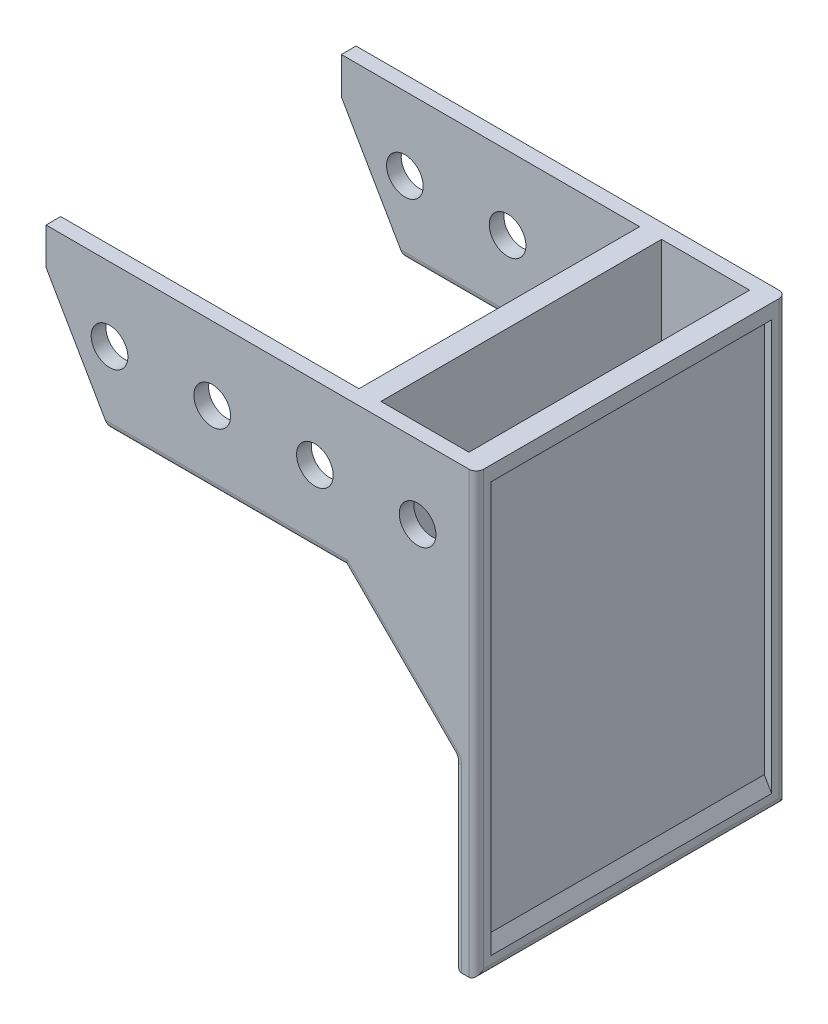
from build123d import *

# Parameters (mm, degrees)
SKETCH2_R           = 3.175
BOSS_EXTRUDE1_DEPTH = 2.54
SKETCH3_R           = 3.175
BOSS_EXTRUDE2_DEPTH = 2.54
SKETCH4_W           = 3.81
SKETCH4_H           = 25.4
BOSS_EXTRUDE3_DEPTH = 48.6
BOSS_EXTRUDE4_DEPTH = 50.8
LPATTERN1_COUNT     = 2
LPATTERN1_PITCH     = 19.05
SKETCH6_W           = 48.6
SKETCH6_H           = 71.12
CUT_EXTRUDE1_DEPTH  = 1.27
BOSS_EXTRUDE5_REACH = 106.623
FILLET1_R           = 8.89
FILLET2_R           = 1.27
CHAMFER1_SIZE       = 2.286
CHAMFER1_SIZE_2     = 1.319822715


# Some blends are built 0.0001 mm under size
with BuildPart() as part:
    # Sketch2 → Boss-Extrude1 (new body)
    with BuildSketch(Plane.XY):
        Polygon((0, -12.7), (63.5, -12.7), (63.5, 12.7), (0, 12.7), (-10.998522628, 12.7), (-10.998522628, 6.35), align=None)
        Circle(SKETCH2_R, mode=Mode.SUBTRACT)
        with Locations((17.78, 0)):
            Circle(SKETCH2_R, mode=Mode.SUBTRACT)
        with Locations((35.56, 0)):
            Circle(SKETCH2_R, mode=Mode.SUBTRACT)
        with Locations((53.34, 0)):
            Circle(SKETCH2_R, mode=Mode.SUBTRACT)
    extrude(amount=BOSS_EXTRUDE1_DEPTH)



with BuildPart() as body_2:
    # Sketch3 → Boss-Extrude2 (new body)
    with BuildSketch(Plane(origin=(0, 0, -48.6), x_dir=(-1, 0, 0), z_dir=(0, 0, -1))):
        Polygon((10.998522628, 12.7), (-63.5, 12.7), (-63.5, -12.7), (0, -12.7), (10.998522628, 6.35), align=None)
        with Locations(Location((0, 0, 0), (0, 0, 180))):
            Circle(SKETCH3_R, mode=Mode.SUBTRACT)
        with Locations(Location((-53.34, 0, 0), (0, 0, 180))):
            Circle(SKETCH3_R, mode=Mode.SUBTRACT)
        with Locations(Location((-35.56, 0, 0), (0, 0, 180))):
            Circle(SKETCH3_R, mode=Mode.SUBTRACT)
        with Locations(Location((-17.78, 0, 0), (0, 0, 180))):
            Circle(SKETCH3_R, mode=Mode.SUBTRACT)
    extrude(amount=BOSS_EXTRUDE2_DEPTH)


with BuildPart() as part_1:
    add(part.part)

    add(body_2.part)  # Boss-Extrude3 merges body 2
    # Sketch4 → Boss-Extrude3 (add)
    with BuildSketch(Plane(origin=(0, 0, 0), x_dir=(-1, 0, 0), z_dir=(0, 0, -1))):
        with Locations((-61.595, 0)):
            Rectangle(SKETCH4_W, SKETCH4_H)
    boss_extrude3 = extrude(amount=BOSS_EXTRUDE3_DEPTH)

    # Sketch5 → Boss-Extrude4 (add)
    with BuildSketch(Plane.XZ.offset(12.7)):
        Polygon((59.69, -48.6), (59.69, 0), (59.69, 2.54), (63.5, 2.54), (63.5, -51.14), (59.69, -51.14), align=None)
    extrude(amount=BOSS_EXTRUDE4_DEPTH)

    # LPattern1: Boss-Extrude3 ×2
    with Locations(*[(-i * LPATTERN1_PITCH, 0, 0) for i in range(1, LPATTERN1_COUNT)]):
        add(boss_extrude3)

    # Sketch6 → Cut-Extrude1 (cut)
    with BuildSketch(Plane(origin=(63.5, 0, 0), x_dir=(0, 0, -1), z_dir=(1, 0, 0))):
        with Locations((24.3, -25.4)):
            Rectangle(SKETCH6_W, SKETCH6_H)
    extrude(amount=-CUT_EXTRUDE1_DEPTH, mode=Mode.SUBTRACT)

    # Boss-Extrude5: up to this face of the body (flat: up to its plane)
    boss_extrude5_end = Plane(part_1.part.faces().sort_by_distance((31.808357107, -3.617906471, -51.14))[0])
    # Sketch7 → Boss-Extrude5 (add, up to the picked face)
    with BuildSketch(Plane.XY.offset(2.54), mode=Mode.PRIVATE) as boss_extrude5_sk1:
        Polygon((40.64, -12.7), (59.69, -31.75), (59.69, -12.7), align=None)
    boss_extrude5_tool1 = split(extrude(boss_extrude5_sk1.sketch, amount=-BOSS_EXTRUDE5_REACH, mode=Mode.PRIVATE), bisect_by=boss_extrude5_end, keep=Keep.BOTH, mode=Mode.PRIVATE)
    add(boss_extrude5_tool1.solids().sort_by(Axis((53.34, -19.05, 2.54), (0, 0, -1)))[0])

    # Fillet1
    fillet1_edges = [part_1.edges().sort_by_distance(p)[0] for p in [
        (40.64, -12.7, -24.3),
    ]]
    fillet(fillet1_edges, radius=FILLET1_R)

    # Fillet2
    fillet2_edges = [part_1.edges().sort_by_distance(p)[0] for p in [
        (20.32, -12.7, -51.14),
        (50.165, -22.225, 2.54),
        (50.165, -22.225, -51.14),
        (59.69, -31.75, -24.3),
        (20.32, -12.7, 0),
        (20.32, -12.7, 2.54),
        (63.5, -25.4, 2.54),
        (63.5, -25.4, -51.14),
        (59.69, -47.625, -51.14),
        (59.69, -47.625, 2.54),
        (59.69, -63.5, -24.3),
        (63.5, -63.5, -24.3),
        (20.32, -12.7, -48.6),
    ]]
    fillet(fillet2_edges, radius=FILLET2_R - 0.0001)  # a hair under: the kernel refuses the full size

    # Chamfer1
    # the kernel refuses this chamfer: 2.286, 1.319822715 mm, written as the material it adds along each edge
    with BuildSketch(Plane(origin=(62.23, -60.96, 0), x_dir=(-0.01932676561270189, 0.9998132206222078, 0), z_dir=(0, 0, -1))) as chamfer1_piece_1_section:
        Polygon((CHAMFER1_SIZE * 0.999813220622, CHAMFER1_SIZE * 0.0193267656127), (-CHAMFER1_SIZE_2 * 0.0193267656181, CHAMFER1_SIZE_2 * 0.999813220901), (0, 0), align=None)
    chamfer1_piece_1 = extrude(amount=48.6, mode=Mode.PRIVATE)
    chamfer1_piece_1 = split(chamfer1_piece_1, bisect_by=Plane(origin=(63.5, -60.18781376, -24.3), z_dir=(-1, 0, 0)), keep=Keep.TOP, mode=Mode.PRIVATE)
    add(chamfer1_piece_1)


solid = part_1.part
